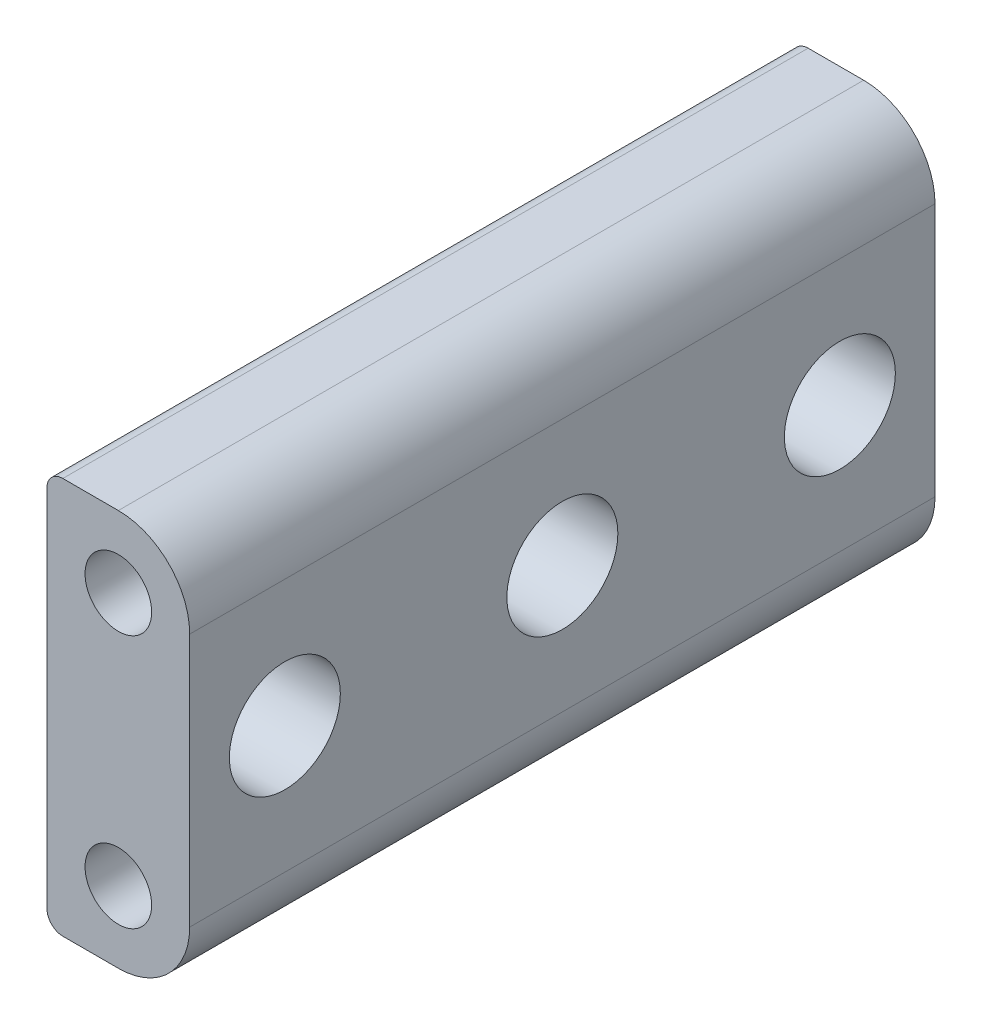
from build123d import *

# Parameters (mm, degrees)
BOSS_EXTRUDE1_DEPTH = 47
SKETCH2_R           = 2.1
CUT_EXTRUDE1_DEPTH  = 4
CUT_EXTRUDE2_START  = -4
SKETCH3_R           = 2.1
CUT_EXTRUDE2_DEPTH  = 4
SKETCH4_R           = 3.5
CUT_EXTRUDE3_DEPTH  = 5
FILLET1_R           = 1


with BuildPart() as part:
    # Sketch1 → Boss-Extrude1 (new body)
    with BuildSketch(Plane.XY):
        with BuildLine():
            Line((-4.5, -4.5), (-4.5, 20.5))
            Line((-4.5, 20.5), (0, 20.5))
            ThreePointArc((0, 20.5), (3.181980515, 19.181980515), (4.5, 16))
            Line((4.5, 16), (4.5, 0))
            ThreePointArc((4.5, 0), (3.181980515, -3.181980515), (0, -4.5))
            Line((0, -4.5), (-4.5, -4.5))
        make_face()
    extrude(amount=BOSS_EXTRUDE1_DEPTH)

    # Sketch2 → Cut-Extrude1 (cut)
    with BuildSketch(Plane.XY.offset(47)):
        with Locations((0, 16)):
            Circle(SKETCH2_R)
        Circle(SKETCH2_R)
    extrude(amount=-CUT_EXTRUDE1_DEPTH, mode=Mode.SUBTRACT)

    # Sketch3 → Cut-Extrude2 (cut)
    with BuildSketch(Plane(origin=(0, 0, 0), x_dir=(-1, 0, 0), z_dir=(0, 0, -1)).offset(CUT_EXTRUDE2_START)):
        Circle(SKETCH3_R)
        with Locations((0, 16)):
            Circle(SKETCH3_R)
    extrude(amount=CUT_EXTRUDE2_DEPTH, mode=Mode.SUBTRACT)

    # Sketch4 → Cut-Extrude3 (cut)
    with BuildSketch(Plane(origin=(4.5, 0, 0), x_dir=(0, 0, -1), z_dir=(1, 0, 0))):
        with Locations((-41, 8)):
            Circle(SKETCH4_R)
        with Locations((-23.5, 8)):
            Circle(SKETCH4_R)
        with Locations((-6, 8)):
            Circle(SKETCH4_R)
    extrude(amount=-CUT_EXTRUDE3_DEPTH, mode=Mode.SUBTRACT)

    # Fillet1
    fillet1_edges = [part.edges().sort_by_distance(p)[0] for p in [
        (-4.5, -4.5, 23.5),
        (-4.5, 20.5, 23.5),
    ]]
    fillet(fillet1_edges, radius=FILLET1_R)


solid = part.part
